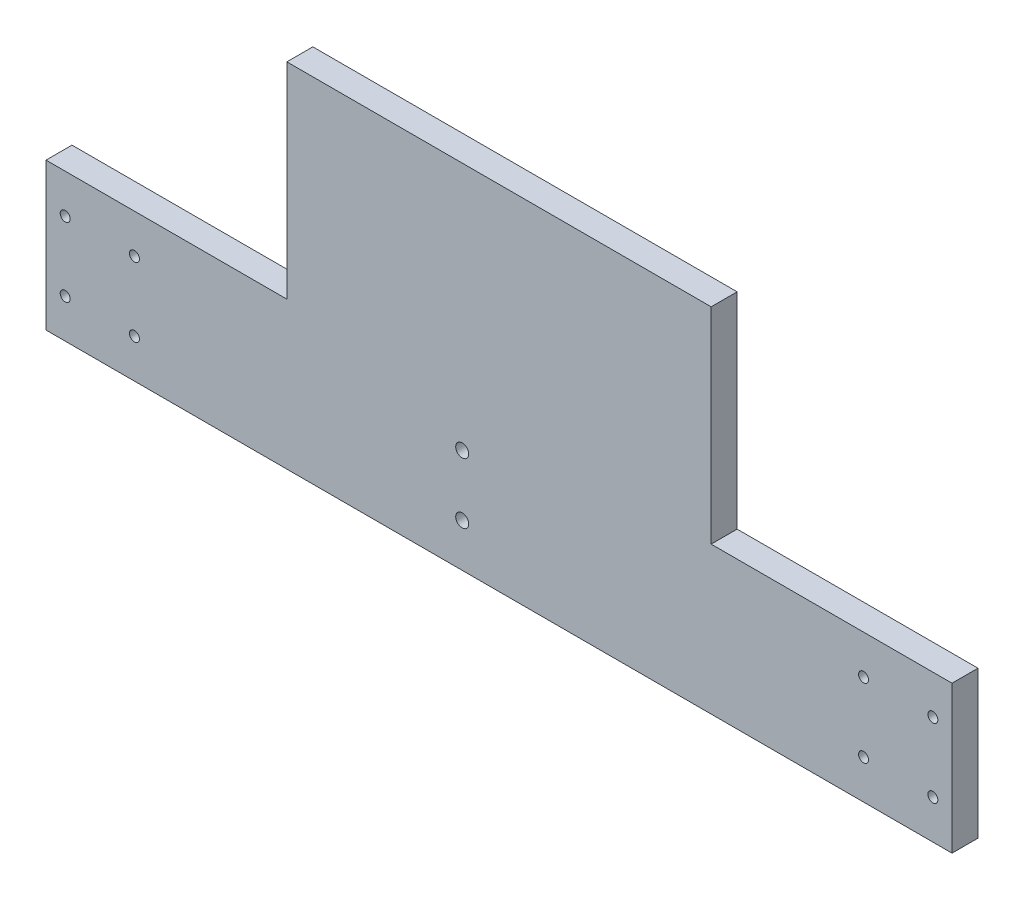
from build123d import *

# Parameters (mm, degrees)
BOSS_EXTRU_1_DEPTH      = 6
ESQUISSE2_R             = 1.15
ESQUISSE2_R_2           = 1.5
ENL_V_MAT_EXTRU_1_DEPTH = 6


with BuildPart() as part:
    # Esquisse1 → Boss.-Extru.1 (new body)
    with BuildSketch(Plane.XY):
        Polygon((-104.63, 17), (-49, 17), (-49, 64.470970022), (49, 64.470970022), (49, 17), (104.63, 17), (104.63, -17), (-104.63, -17), align=None)
    extrude(amount=BOSS_EXTRU_1_DEPTH)

    # Esquisse2 → Enlèv. mat.-Extru.1 (cut)
    with BuildSketch(Plane.XY.offset(6)):
        with Locations((-100.2, 8)):
            Circle(ESQUISSE2_R)
        with Locations((-84.2, 8)):
            Circle(ESQUISSE2_R)
        with Locations((-84.2, -8)):
            Circle(ESQUISSE2_R)
        with Locations((-100.2, -8)):
            Circle(ESQUISSE2_R)
        with Locations((100.2, -8)):
            Circle(ESQUISSE2_R)
        with Locations((84.2, -8)):
            Circle(ESQUISSE2_R)
        with Locations((84.2, 8)):
            Circle(ESQUISSE2_R)
        with Locations((100.2, 8)):
            Circle(ESQUISSE2_R)
        with Locations((-8.5, 7)):
            Circle(ESQUISSE2_R_2)
        with Locations((-8.5, -7)):
            Circle(ESQUISSE2_R_2)
    extrude(amount=-ENL_V_MAT_EXTRU_1_DEPTH, mode=Mode.SUBTRACT)


solid = part.part
